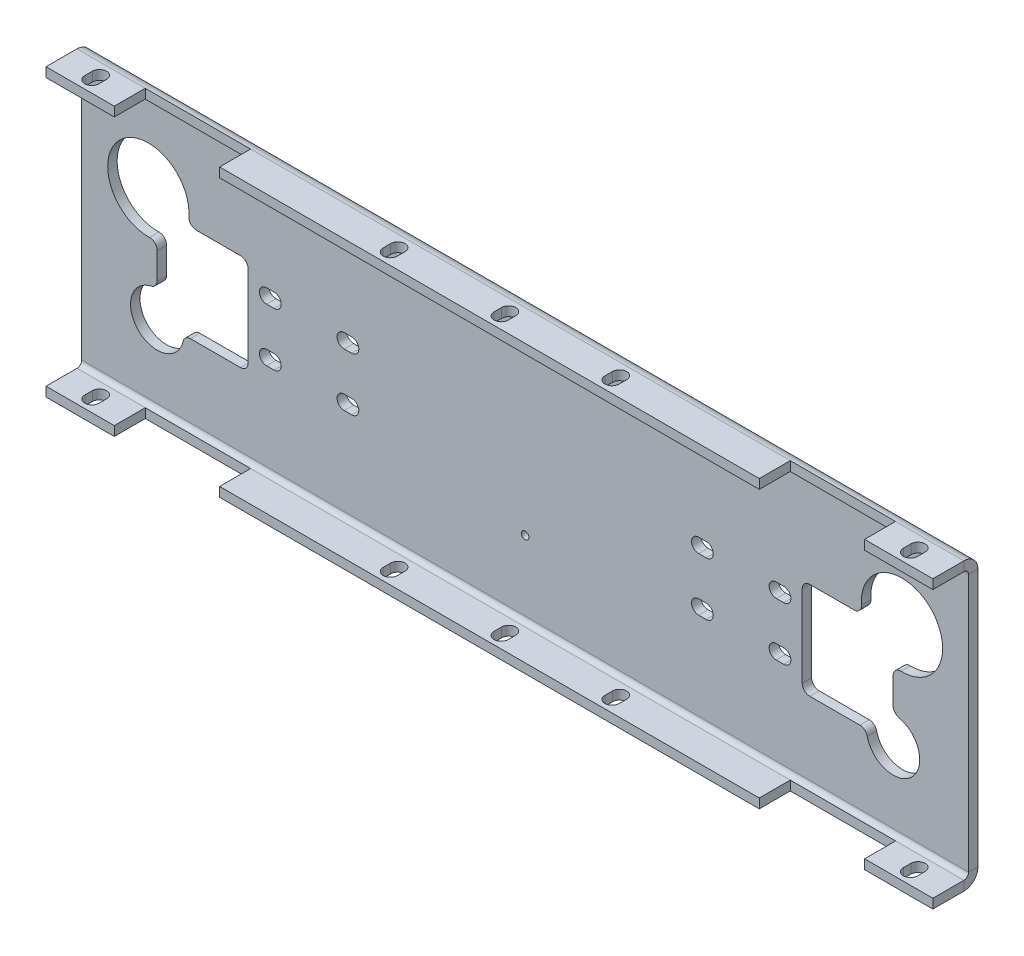
from build123d import *

# Parameters (mm, degrees)
SKETCH1_R                      = 1.27
BOSS_EXTRUDE1_DEPTH            = 3.175
EDGE_FLANGE1_STRIP_W           = 15.900000204
EDGE_FLANGE1_STRIP_H           = 3.175
EDGE_FLANGE1_STRIP_CUT_DEPTH   = 299.398126018
EDGE_FLANGE1_STRIP_2_W         = 15.900000204
EDGE_FLANGE1_STRIP_2_H         = 3.175
EDGE_FLANGE1_STRIP_CUT_2_DEPTH = 299.398126018
EDGE_FLANGE1_DEPTH             = 299.398126018
EDGE_FLANGE1_BEND_DEPTH        = 299.398126018
CUT_EXTRUDE1_DEPTH             = 352.105905289
FILLET1_R                      = 2.54
CUT_EXTRUDE2_DEPTH             = 328.367830479
SKETCH24_W                     = 35.56
SKETCH24_H                     = 10.464999898
CUT_EXTRUDE3_DEPTH             = 328.367830479
CUT_EXTRUDE4_DEPTH             = 328.367830479


# Sheet-metal steps are written as plain solids
with BuildPart() as part:
    # Sketch1 → Boss-Extrude1 (new body)
    with BuildSketch(Plane.XY):
        Polygon((13.027941433, 139.759205886), (13.027941433, 83.160385886), (13.027941433, 63.170585886), (312.426067451, 63.170585886), (312.426067451, 83.160385886), (312.426067451, 139.759205886), (312.426067451, 159.749005886), (13.027941433, 159.749005886), align=None)
        with Locations((76.695557497, 117.909047818)):
            Circle(SKETCH1_R, mode=Mode.SUBTRACT)
        with Locations((102.895189625, 117.909047818)):
            Circle(SKETCH1_R, mode=Mode.SUBTRACT)
        with Locations((76.695557497, 99.909047818)):
            Circle(SKETCH1_R, mode=Mode.SUBTRACT)
        with Locations((102.895189625, 99.909047818)):
            Circle(SKETCH1_R, mode=Mode.SUBTRACT)
        with Locations((162.727004442, 91.563754554)):
            Circle(SKETCH1_R, mode=Mode.SUBTRACT)
        with Locations((222.558819258, 117.909047818)):
            Circle(SKETCH1_R, mode=Mode.SUBTRACT)
        with Locations((222.558819258, 99.909047818)):
            Circle(SKETCH1_R, mode=Mode.SUBTRACT)
        with Locations((248.758451386, 117.909047818)):
            Circle(SKETCH1_R, mode=Mode.SUBTRACT)
        with Locations((248.758451386, 99.909047818)):
            Circle(SKETCH1_R, mode=Mode.SUBTRACT)
        with BuildLine():
            Line((38.495741433, 112.714884205), (38.495741433, 103.795804516))
            ThreePointArc((38.495741433, 103.795804516), (37.939936051, 102.2100644), (36.515763704, 101.318310812))
            ThreePointArc((36.515763704, 101.318310812), (32.889303487, 85.543860468), (47.475997554, 92.559047818))
            Line((47.475997554, 92.559047818), (66.655741433, 92.559047818))
            ThreePointArc((66.655741433, 92.559047818), (68.451792657, 93.302996594), (69.195741433, 95.099047818))
            Line((69.195741433, 95.099047818), (69.195741433, 122.719047818))
            ThreePointArc((69.195741433, 122.719047818), (68.451792657, 124.515099042), (66.655741433, 125.259047818))
            Line((66.655741433, 125.259047818), (51.734500869, 125.259047818))
            ThreePointArc((51.734500869, 125.259047818), (49.874935778, 126.06884041), (49.201088825, 127.981868547))
            ThreePointArc((49.201088825, 127.981868547), (26.035098733, 138.887104645), (35.887081184, 115.253956037))
            ThreePointArc((35.887081184, 115.253956037), (37.727351289, 114.535048625), (38.495741433, 112.714884205))
        make_face(mode=Mode.SUBTRACT)
        with BuildLine():
            Line((286.958267451, 112.714884205), (286.958267451, 103.795804516))
            ThreePointArc((286.958267451, 103.795804516), (287.514072832, 102.2100644), (288.938245179, 101.318310812))
            ThreePointArc((288.938245179, 101.318310812), (292.564705397, 85.543860468), (277.97801133, 92.559047818))
            Line((277.97801133, 92.559047818), (258.798267451, 92.559047818))
            ThreePointArc((258.798267451, 92.559047818), (257.002216226, 93.302996594), (256.258267451, 95.099047818))
            Line((256.258267451, 95.099047818), (256.258267451, 122.719047818))
            ThreePointArc((256.258267451, 122.719047818), (257.002216226, 124.515099042), (258.798267451, 125.259047818))
            Line((258.798267451, 125.259047818), (273.719508015, 125.259047818))
            ThreePointArc((273.719508015, 125.259047818), (275.579073105, 126.06884041), (276.252920058, 127.981868547))
            ThreePointArc((276.252920058, 127.981868547), (299.418910151, 138.887104645), (289.5669277, 115.253956037))
            ThreePointArc((289.5669277, 115.253956037), (287.726657594, 114.535048625), (286.958267451, 112.714884205))
        make_face(mode=Mode.SUBTRACT)
    extrude(amount=BOSS_EXTRUDE1_DEPTH)

    # Edge-Flange1 strip (across the edge) → Edge-Flange1 strip cut (cut)
    with BuildSketch(Plane(origin=(312.426067451, 159.749005886, 3.175), x_dir=(0, -1, 0), z_dir=(-1, 0, 0))):
        with Locations((-3.175, -1.5875)):
            Rectangle(EDGE_FLANGE1_STRIP_W, EDGE_FLANGE1_STRIP_H)
    extrude(amount=EDGE_FLANGE1_STRIP_CUT_DEPTH, mode=Mode.SUBTRACT)

    # Edge-Flange1 strip 2 (across the edge) → Edge-Flange1 strip cut 2 (cut)
    with BuildSketch(Plane(origin=(13.027941433, 63.170585886, 3.175), x_dir=(0, 1, 0), z_dir=(1, 0, 0))):
        with Locations((-3.175, -1.5875)):
            Rectangle(EDGE_FLANGE1_STRIP_2_W, EDGE_FLANGE1_STRIP_2_H)
    extrude(amount=EDGE_FLANGE1_STRIP_CUT_2_DEPTH, mode=Mode.SUBTRACT)

    # Edge-Flange1 section (across the edge) → Edge-Flange1 (add)
    with BuildSketch(Plane(origin=(312.426067451, 159.749005886, 3.175), x_dir=(0, -1, 0), z_dir=(-1, 0, 0))):
        with BuildLine():
            Line((0, 1.600000102), (0, 12.065))
            Line((0, 12.065), (3.175, 12.065))
            Line((3.175, 12.065), (3.175, 1.600000102))
            ThreePointArc((3.175, 1.600000102), (3.64362918, 0.46862918), (4.775000102, 0))
            Line((4.775000102, 0), (4.775000102, -3.175))
            ThreePointArc((4.775000102, -3.175), (1.39856515, -1.77643485), (0, 1.600000102))
        make_face()
    extrude(amount=EDGE_FLANGE1_DEPTH)

    # Edge-Flange1 section 2 (across the edge) → Edge-Flange1 bend (add)
    with BuildSketch(Plane(origin=(13.027941433, 63.170585886, 3.175), x_dir=(0, 1, 0), z_dir=(1, 0, 0))):
        with BuildLine():
            Line((0, 1.600000102), (0, 12.065))
            Line((0, 12.065), (3.175, 12.065))
            Line((3.175, 12.065), (3.175, 1.600000102))
            ThreePointArc((3.175, 1.600000102), (3.64362918, 0.46862918), (4.775000102, 0))
            Line((4.775000102, 0), (4.775000102, -3.175))
            ThreePointArc((4.775000102, -3.175), (1.39856515, -1.77643485), (0, 1.600000102))
        make_face()
    extrude(amount=EDGE_FLANGE1_BEND_DEPTH)

    # Sketch18 → Cut-Extrude1 (cut, through all)
    with BuildSketch(Plane.XY.offset(3.175)):
        with BuildLine():
            Line((75.425557497, 120.309347818), (77.965557497, 120.309347818))
            ThreePointArc((77.965557497, 120.309347818), (80.365857497, 117.909047818), (77.965557497, 115.508747818))
            Line((77.965557497, 115.508747818), (75.425557497, 115.508747818))
            ThreePointArc((75.425557497, 115.508747818), (73.025257497, 117.909047818), (75.425557497, 120.309347818))
        make_face()
        with BuildLine():
            Line((101.625189625, 120.309347818), (104.165189625, 120.309347818))
            ThreePointArc((104.165189625, 120.309347818), (106.565489625, 117.909047818), (104.165189625, 115.508747818))
            Line((104.165189625, 115.508747818), (101.625189625, 115.508747818))
            ThreePointArc((101.625189625, 115.508747818), (99.224889625, 117.909047818), (101.625189625, 120.309347818))
        make_face()
        with BuildLine():
            Line((75.425557497, 102.309347818), (77.965557497, 102.309347818))
            ThreePointArc((77.965557497, 102.309347818), (80.365857497, 99.909047818), (77.965557497, 97.508747818))
            Line((77.965557497, 97.508747818), (75.425557497, 97.508747818))
            ThreePointArc((75.425557497, 97.508747818), (73.025257497, 99.909047818), (75.425557497, 102.309347818))
        make_face()
        with BuildLine():
            Line((101.625189625, 102.309347818), (104.165189625, 102.309347818))
            ThreePointArc((104.165189625, 102.309347818), (106.565489625, 99.909047818), (104.165189625, 97.508747818))
            Line((104.165189625, 97.508747818), (101.625189625, 97.508747818))
            ThreePointArc((101.625189625, 97.508747818), (99.224889625, 99.909047818), (101.625189625, 102.309347818))
        make_face()
        with BuildLine():
            Line((221.288819258, 102.309347818), (223.828819258, 102.309347818))
            ThreePointArc((223.828819258, 102.309347818), (226.229119258, 99.909047818), (223.828819258, 97.508747818))
            Line((223.828819258, 97.508747818), (221.288819258, 97.508747818))
            ThreePointArc((221.288819258, 97.508747818), (218.888519258, 99.909047818), (221.288819258, 102.309347818))
        make_face()
        with BuildLine():
            Line((221.288819258, 120.309347818), (223.828819258, 120.309347818))
            ThreePointArc((223.828819258, 120.309347818), (226.229119258, 117.909047818), (223.828819258, 115.508747818))
            Line((223.828819258, 115.508747818), (221.288819258, 115.508747818))
            ThreePointArc((221.288819258, 115.508747818), (218.888519258, 117.909047818), (221.288819258, 120.309347818))
        make_face()
        with BuildLine():
            Line((247.488451386, 120.309347818), (250.028451386, 120.309347818))
            ThreePointArc((250.028451386, 120.309347818), (252.428751386, 117.909047818), (250.028451386, 115.508747818))
            Line((250.028451386, 115.508747818), (247.488451386, 115.508747818))
            ThreePointArc((247.488451386, 115.508747818), (245.088151386, 117.909047818), (247.488451386, 120.309347818))
        make_face()
        with BuildLine():
            Line((247.488451386, 102.309347818), (250.028451386, 102.309347818))
            ThreePointArc((250.028451386, 102.309347818), (252.428751386, 99.909047818), (250.028451386, 97.508747818))
            Line((250.028451386, 97.508747818), (247.488451386, 97.508747818))
            ThreePointArc((247.488451386, 97.508747818), (245.088151386, 99.909047818), (247.488451386, 102.309347818))
        make_face()
    extrude(amount=-CUT_EXTRUDE1_DEPTH, mode=Mode.SUBTRACT)

    # Fillet1
    fillet1_edges = [part.edges().sort_by_distance(p)[0] for p in [
        (47.475997554, 92.559047818, 1.5875),
        (277.97801133, 92.559047818, 1.5875),
    ]]
    fillet(fillet1_edges, radius=FILLET1_R)

    # Sketch19 → Cut-Extrude2 (cut, through all)
    with BuildSketch(Plane.XZ.offset(-63.170585886)):
        with BuildLine():
            Line((48.052407185, 8.737500051), (48.052407185, 11.277500051))
            ThreePointArc((48.052407185, 11.277500051), (50.452707185, 13.677800051), (52.853007185, 11.277500051))
            Line((52.853007185, 11.277500051), (52.853007185, 8.737500051))
            ThreePointArc((52.853007185, 8.737500051), (50.452707185, 6.337200051), (48.052407185, 8.737500051))
        make_face()
        with BuildLine():
            Line((127.702538689, 8.737500051), (127.702538689, 11.277500051))
            ThreePointArc((127.702538689, 11.277500051), (125.302238689, 13.677800051), (122.901938689, 11.277500051))
            Line((122.901938689, 11.277500051), (122.901938689, 8.737500051))
            ThreePointArc((122.901938689, 8.737500051), (125.302238689, 6.337200051), (127.702538689, 8.737500051))
        make_face()
        with BuildLine():
            Line((197.751470194, 8.737500051), (197.751470194, 11.277500051))
            ThreePointArc((197.751470194, 11.277500051), (200.151770194, 13.677800051), (202.552070194, 11.277500051))
            Line((202.552070194, 11.277500051), (202.552070194, 8.737500051))
            ThreePointArc((202.552070194, 8.737500051), (200.151770194, 6.337200051), (197.751470194, 8.737500051))
        make_face()
        with BuildLine():
            Line((277.401601698, 8.737500051), (277.401601698, 11.277500051))
            ThreePointArc((277.401601698, 11.277500051), (275.001301698, 13.677800051), (272.601001698, 11.277500051))
            Line((272.601001698, 11.277500051), (272.601001698, 8.737500051))
            ThreePointArc((272.601001698, 8.737500051), (275.001301698, 6.337200051), (277.401601698, 8.737500051))
        make_face()
        with BuildLine():
            Line((165.127304442, 11.277500051), (165.127304442, 8.737500051))
            ThreePointArc((165.127304442, 8.737500051), (162.727004442, 6.337200051), (160.326704442, 8.737500051))
            Line((160.326704442, 8.737500051), (160.326704442, 11.277500051))
            ThreePointArc((160.326704442, 11.277500051), (162.727004442, 13.677800051), (165.127304442, 11.277500051))
        make_face()
    extrude(amount=-CUT_EXTRUDE2_DEPTH, mode=Mode.SUBTRACT)

    # Sketch24 → Cut-Extrude3 (cut, through all)
    with BuildSketch(Plane.XZ.offset(-63.170585886)):
        with Locations((53.853714442, 10.007500051)):
            Rectangle(SKETCH24_W, SKETCH24_H)
        with Locations((271.600294442, 10.007500051)):
            Rectangle(SKETCH24_W, SKETCH24_H)
    extrude(amount=-CUT_EXTRUDE3_DEPTH, mode=Mode.SUBTRACT)

    # Sketch25 → Cut-Extrude4 (cut, through all)
    with BuildSketch(Plane.XZ.offset(-63.170585886)):
        with BuildLine():
            Line((22.150527937, 8.737500051), (22.150527937, 11.277500051))
            ThreePointArc((22.150527937, 11.277500051), (24.550827937, 13.677800051), (26.951127937, 11.277500051))
            Line((26.951127937, 11.277500051), (26.951127937, 8.737500051))
            ThreePointArc((26.951127937, 8.737500051), (24.550827937, 6.337200051), (22.150527937, 8.737500051))
        make_face()
        with BuildLine():
            Line((303.303480946, 8.737500051), (303.303480946, 11.277500051))
            ThreePointArc((303.303480946, 11.277500051), (300.903180946, 13.677800051), (298.502880946, 11.277500051))
            Line((298.502880946, 11.277500051), (298.502880946, 8.737500051))
            ThreePointArc((298.502880946, 8.737500051), (300.903180946, 6.337200051), (303.303480946, 8.737500051))
        make_face()
    extrude(amount=-CUT_EXTRUDE4_DEPTH, mode=Mode.SUBTRACT)


solid = part.part
